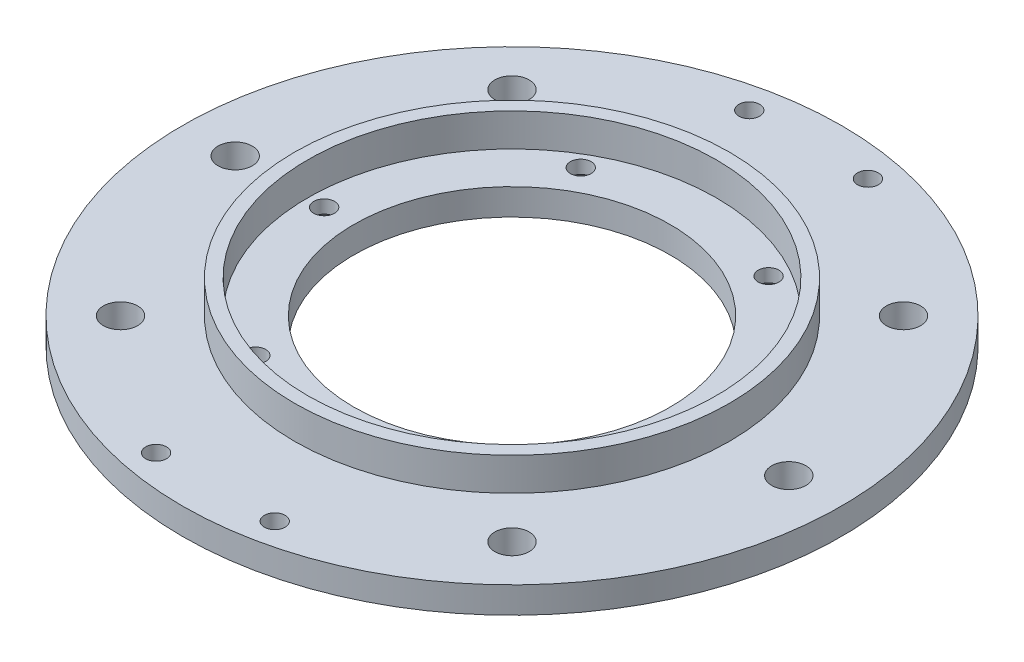
from build123d import *

# Parameters (mm, degrees)
SKETCH_1_R                  = 50
SKETCH_1_R_2                = 24
EXTRUDE_1_DEPTH             = 4
PATTERN_CIRCULAR_1_COUNT    = 6
CHAMFER_1_SIZE              = 2
HOLE_WIZARD_M32_D           = 3.15
PATTERN_LINEAR_1_COUNT      = 2
PATTERN_LINEAR_1_PITCH      = 18
PATTERN_LINEAR_1_COUNT_DIR2 = 2
PATTERN_LINEAR_1_PITCH_DIR2 = 90
HOLE_WIZARD_M52_D           = 5.2
PATTERN_CIRCULAR_3_COUNT    = 2
PATTERN_CIRCULAR_3_ANGLE    = 45
F_3_THE_OTHER_WAY_COUNT     = 2
F_3_THE_OTHER_WAY_ANGLE     = 45
SKETCH_14_R                 = 33
SKETCH_14_R_2               = 31
EXTRUDE_2_DEPTH             = 5


with BuildPart() as part:
    # Эскиз1 → Бобышка-Вытянуть1 (new body)
    with BuildSketch(Plane(origin=(0, 0, 0), x_dir=(1, 0, 0), z_dir=(0, 1, 0))):
        Circle(SKETCH_1_R)
        Circle(SKETCH_1_R_2, mode=Mode.SUBTRACT)
    extrude(amount=EXTRUDE_1_DEPTH)

    # Эскиз3 → Сверло под метчик  спиральное M31 (revolve, cut)
    with BuildSketch(Plane(origin=(28.5, 4, 0), x_dir=(0, 0, 1), z_dir=(1, 0, 0))):
        Polygon((0, 0), (0, 8.946355475), (1.575, 8), (1.575, 0), align=None)
    hole_wizard_m31 = revolve(axis=Axis((28.5, 10.35, 0), (0, -1, 0)), mode=Mode.SUBTRACT)

    # Круговой массив1: Сверло под метчик  спиральное M31 ×6 about axis
    pattern_circular_1_axis = Axis((0, 4, 0), (0, 1, 0))
    for i in range(1, PATTERN_CIRCULAR_1_COUNT):
        add(hole_wizard_m31.rotate(pattern_circular_1_axis, i * 360 / PATTERN_CIRCULAR_1_COUNT), mode=Mode.SUBTRACT)

    # Фаска1
    chamfer_1_edges = [part.edges().sort_by_distance(p)[0] for p in [
        (-12.886009989, 0, 25.469224008),
        (-28.5, 0, 1.575),
        (-15.613990011, 0, -23.894224008),
        (12.886009989, 0, -25.469224008),
        (28.5, 0, -1.575),
        (15.613990011, 0, 23.894224008),
    ]]
    chamfer(chamfer_1_edges, length=CHAMFER_1_SIZE)

    # Сверло под метчик  спиральное M32 (through all)
    with Locations(Plane(origin=(0, 0, 0), x_dir=(-1, 0, 0), z_dir=(0, -1, 0))):
        with Locations((-9, -45)):
            hole_wizard_m32 = Hole(HOLE_WIZARD_M32_D / 2)

    # Линейный массив1: Hole Wizard M32 2 × 2
    with Locations(*[(-i * PATTERN_LINEAR_1_PITCH, 0, -j * PATTERN_LINEAR_1_PITCH_DIR2) for i in range(PATTERN_LINEAR_1_COUNT) for j in range(PATTERN_LINEAR_1_COUNT_DIR2) if (i, j) != (0, 0)]):
        add(hole_wizard_m32, mode=Mode.SUBTRACT)

    # Сверло под метчик  спиральное M52 (through all)
    with Locations(Plane(origin=(0, 0, 0), x_dir=(-1, 0, 0), z_dir=(0, -1, 0))):
        with Locations((42, 0), (-42, 0)):
            hole_wizard_m52 = Hole(HOLE_WIZARD_M52_D / 2)

    # Круговой массив3: Сверло под метчик  спиральное M52 ×2 about axis
    pattern_circular_3_axis = Axis((0, 0, 0), (0, 1, 0))
    for i in range(1, PATTERN_CIRCULAR_3_COUNT):
        add(hole_wizard_m52.rotate(pattern_circular_3_axis, i * PATTERN_CIRCULAR_3_ANGLE / (PATTERN_CIRCULAR_3_COUNT - 1)), mode=Mode.SUBTRACT)

    # 3 the other way: Сверло под метчик  спиральное M52 ×2 about axis
    f_3_the_other_way_axis = Axis((0, 0, 0), (0, -1, 0))
    for i in range(1, F_3_THE_OTHER_WAY_COUNT):
        add(hole_wizard_m52.rotate(f_3_the_other_way_axis, i * F_3_THE_OTHER_WAY_ANGLE / (F_3_THE_OTHER_WAY_COUNT - 1)), mode=Mode.SUBTRACT)

    # Эскиз14 → Бобышка-Вытянуть2 (add)
    with BuildSketch(Plane(origin=(0, 4, 0), x_dir=(1, 0, 0), z_dir=(0, 1, 0))):
        Circle(SKETCH_14_R)
        Circle(SKETCH_14_R_2, mode=Mode.SUBTRACT)
    extrude(amount=EXTRUDE_2_DEPTH)


solid = part.part
